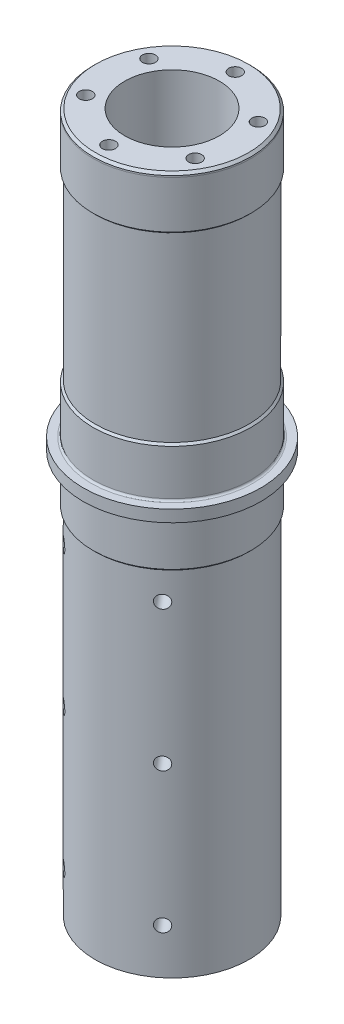
from build123d import *

# Parameters (mm, degrees)
SKETCH6_W                     = 2.15
SKETCH6_H                     = 180.5
M4_CLEARANCE_HOLE2_AT_2_COUNT = 2
M4_CLEARANCE_HOLE2_AT_2_PITCH = 16
M4_CLEARANCE_HOLE2_AT_3_COUNT = 2
M4_CLEARANCE_HOLE2_AT_3_PITCH = 27.712812921
M4_CLEARANCE_HOLE2_AT_4_COUNT = 2
M4_CLEARANCE_HOLE2_AT_4_PITCH = 32
M4_CLEARANCE_HOLE2_AT_5_COUNT = 2
M4_CLEARANCE_HOLE2_AT_5_PITCH = 27.712812921
M4_CLEARANCE_HOLE2_AT_6_COUNT = 2
M4_CLEARANCE_HOLE2_AT_6_PITCH = 16
M4_TAPPED_HOLE1_AT_2_COUNT    = 2
M4_TAPPED_HOLE1_AT_2_PITCH    = 16
M4_TAPPED_HOLE1_AT_3_COUNT    = 2
M4_TAPPED_HOLE1_AT_3_PITCH    = 27.712812921
M4_TAPPED_HOLE1_AT_4_COUNT    = 2
M4_TAPPED_HOLE1_AT_4_PITCH    = 16
M4_TAPPED_HOLE1_AT_5_COUNT    = 2
M4_TAPPED_HOLE1_AT_5_PITCH    = 27.712812921
M4_TAPPED_HOLE1_AT_6_COUNT    = 2
M4_TAPPED_HOLE1_AT_6_PITCH    = 32
SKETCH16_W                    = 1.65
SKETCH16_H                    = 19.5
SKETCH16_AT_POINT_2_W         = 1.65
SKETCH16_AT_POINT_2_H         = 19.5
SKETCH16_AT_POINT_3_W         = 1.65
SKETCH16_AT_POINT_3_H         = 19.5
SKETCH16_AT_POINT_4_W         = 1.65
SKETCH16_AT_POINT_4_H         = 19.5
SKETCH16_AT_POINT_5_W         = 1.65
SKETCH16_AT_POINT_5_H         = 19.5
SKETCH16_AT_POINT_6_W         = 1.65
SKETCH16_AT_POINT_6_H         = 19.5
CHAMFER1_SIZE                 = 0.6
FILLET1_R                     = 0.5
FILLET2_R                     = 0.4
CHAMFER2_SIZE                 = 0.5


with BuildPart() as part:
    # Sketch1 → Revolve1 (revolve)
    with BuildSketch(Plane(origin=(0, 0, 0), x_dir=(0, 0, -1), z_dir=(1, 0, 0)), mode=Mode.PRIVATE) as revolve1_sk:
        Polygon((50, 130), (50, 117), (49.5, 117), (49.5, 70), (50, 70), (50, 58), (52.5, 58), (52.5, 55), (50, 55), (50, 42.5), (49.5, 42.5), (49.5, -47), (40.5, -47), (40.5, 62.5), (42, 62.5), (42, 130), align=None)
    revolve(revolve1_sk.sketch.rotate(Axis((0, 145.844079722, -30), (0, -1, 0)), 180), axis=Axis((0, 145.844079722, -30), (0, -1, 0)))

    # Sketch12 → M4 Tapped Hole1 (revolve, cut)
    with BuildSketch(Plane(origin=(0, 130, -46), x_dir=(0, 0, 1), z_dir=(1, 0, 0))):
        Polygon((0, 0), (0, 12.491420021), (1.65, 11.5), (1.65, 0), align=None)
    m4_tapped_hole1 = revolve(axis=Axis((0, 136.35, -46), (0, -1, 0)), mode=Mode.SUBTRACT)

    # M4 Tapped Hole1 at 2: M4 Tapped Hole1 ×2
    with Locations(*[Vector(0.8660254037844387, 0, 0.5000000000000001) * (i * M4_TAPPED_HOLE1_AT_2_PITCH) for i in range(1, M4_TAPPED_HOLE1_AT_2_COUNT)]):
        add(m4_tapped_hole1, mode=Mode.SUBTRACT)

    # M4 Tapped Hole1 at 3: M4 Tapped Hole1 ×2
    with Locations(*[Vector(0.5000000000000002, 0, 0.8660254037844386) * (i * M4_TAPPED_HOLE1_AT_3_PITCH) for i in range(1, M4_TAPPED_HOLE1_AT_3_COUNT)]):
        add(m4_tapped_hole1, mode=Mode.SUBTRACT)

    # M4 Tapped Hole1 at 4: M4 Tapped Hole1 ×2
    with Locations(*[Vector(-0.8660254037844387, 0, 0.5000000000000001) * (i * M4_TAPPED_HOLE1_AT_4_PITCH) for i in range(1, M4_TAPPED_HOLE1_AT_4_COUNT)]):
        add(m4_tapped_hole1, mode=Mode.SUBTRACT)

    # M4 Tapped Hole1 at 5: M4 Tapped Hole1 ×2
    with Locations(*[Vector(-0.4999999999999997, 0, 0.8660254037844388) * (i * M4_TAPPED_HOLE1_AT_5_PITCH) for i in range(1, M4_TAPPED_HOLE1_AT_5_COUNT)]):
        add(m4_tapped_hole1, mode=Mode.SUBTRACT)

    # M4 Tapped Hole1 at 6: M4 Tapped Hole1 ×2
    with Locations(*[(0, 0, i * M4_TAPPED_HOLE1_AT_6_PITCH) for i in range(1, M4_TAPPED_HOLE1_AT_6_COUNT)]):
        add(m4_tapped_hole1, mode=Mode.SUBTRACT)

    # Sketch16 → M4 Tapped Hole2 (revolve, cut)
    with BuildSketch(Plane(origin=(12.534358389, 35.5, -15.062133359), x_dir=(0.7660444431189759, 0, -0.642787609686542), z_dir=(0, 1, 0))):
        with Locations((0.825, 9.75)):
            Rectangle(SKETCH16_W, SKETCH16_H)
    revolve(axis=Axis((16.61605971, 35.5, -10.197751145), (-0.6427876096865419, 0, -0.7660444431189758)), mode=Mode.SUBTRACT)

    # Sketch16 at point 2 (carried to point 2, square into its face) → M4 Tapped Hole2 at 2 (revolve, cut)
    with BuildSketch(Plane(origin=(12.534358389, 0, -15.062133359), x_dir=(0.766044068, 0, -0.642788057), z_dir=(0, 1, 0))):
        with Locations((0.825, 9.75)):
            Rectangle(SKETCH16_AT_POINT_2_W, SKETCH16_AT_POINT_2_H)
    revolve(axis=Axis((16.61606255, 0, -10.197753528), (-0.642788057, 0, -0.766044068)), mode=Mode.SUBTRACT)

    # Sketch16 at point 3 (carried to point 3, square into its face) → M4 Tapped Hole2 at 3 (revolve, cut)
    with BuildSketch(Plane(origin=(12.534358389, -35.5, -15.062133359), x_dir=(0.766044068, 0, -0.642788057), z_dir=(0, 1, 0))):
        with Locations((0.825, 9.75)):
            Rectangle(SKETCH16_AT_POINT_3_W, SKETCH16_AT_POINT_3_H)
    revolve(axis=Axis((16.61606255, -35.5, -10.197753528), (-0.642788057, 0, -0.766044068)), mode=Mode.SUBTRACT)

    # Sketch16 at point 4 (carried to point 4, square into its face) → M4 Tapped Hole2 at 4 (revolve, cut)
    with BuildSketch(Plane(origin=(-12.534358389, -35.5, -15.062133359), x_dir=(0.766044068, 0, 0.642788057), z_dir=(0, 1, 0))):
        with Locations((0.825, 9.75)):
            Rectangle(SKETCH16_AT_POINT_4_W, SKETCH16_AT_POINT_4_H)
    revolve(axis=Axis((-16.61606255, -35.5, -10.197753528), (0.642788057, 0, -0.766044068)), mode=Mode.SUBTRACT)

    # Sketch16 at point 5 (carried to point 5, square into its face) → M4 Tapped Hole2 at 5 (revolve, cut)
    with BuildSketch(Plane(origin=(-12.534358389, 0, -15.062133359), x_dir=(0.766044068, 0, 0.642788057), z_dir=(0, 1, 0))):
        with Locations((0.825, 9.75)):
            Rectangle(SKETCH16_AT_POINT_5_W, SKETCH16_AT_POINT_5_H)
    revolve(axis=Axis((-16.61606255, 0, -10.197753528), (0.642788057, 0, -0.766044068)), mode=Mode.SUBTRACT)

    # Sketch16 at point 6 (carried to point 6, square into its face) → M4 Tapped Hole2 at 6 (revolve, cut)
    with BuildSketch(Plane(origin=(-12.534358389, 35.5, -15.062133359), x_dir=(0.766044068, 0, 0.642788057), z_dir=(0, 1, 0))):
        with Locations((0.825, 9.75)):
            Rectangle(SKETCH16_AT_POINT_6_W, SKETCH16_AT_POINT_6_H)
    revolve(axis=Axis((-16.61606255, 35.5, -10.197753528), (0.642788057, 0, -0.766044068)), mode=Mode.SUBTRACT)

    # Chamfer1
    chamfer1_edges = [part.edges().sort_by_distance(p)[0] for p in [
        (0, 130, -50),
    ]]
    chamfer(chamfer1_edges, length=CHAMFER1_SIZE)

    # Fillet1
    fillet1_edges = [part.edges().sort_by_distance(p)[0] for p in [
        (0, 58, -50),
        (0, 55, -50),
    ]]
    fillet(fillet1_edges, radius=FILLET1_R)

    # Chamfer2
    chamfer2_edges = [part.edges().sort_by_distance(p)[0] for p in [
        (0, 42.5, -50),
        (0, 117, -49.5),
        (0, 70, -49.5),
    ]]
    chamfer(chamfer2_edges, length=CHAMFER2_SIZE - 0.0001)  # a hair under: the kernel refuses the full size


with BuildPart() as body_2:
    # Sketch2 → Revolve2 (revolve)
    with BuildSketch(Plane(origin=(0, 0, 0), x_dir=(0, 0, -1), z_dir=(1, 0, 0)), mode=Mode.PRIVATE) as revolve2_sk:
        Polygon((42, 133.5), (52.5, 133.5), (52.5, 129), (50, 129), (50, 130.5), (42, 130.5), align=None)
    revolve(revolve2_sk.sketch.rotate(Axis((0, 145.844079722, -30), (0, -1, 0)), 180), axis=Axis((0, 145.844079722, -30), (0, -1, 0)))

    # Sketch6 → M4 Clearance Hole2 (revolve, cut)
    with BuildSketch(Plane(origin=(-13.856406461, 133.5, -38), x_dir=(0, 0, 1), z_dir=(1, 0, 0))):
        with Locations((1.075, 90.25)):
            Rectangle(SKETCH6_W, SKETCH6_H)
    m4_clearance_hole2 = revolve(axis=Axis((-13.856406461, 139.85, -38), (0, -1, 0)), mode=Mode.SUBTRACT)

    # M4 Clearance Hole2 at 2: M4 Clearance Hole2 ×2
    with Locations(*[Vector(0.8660254037844387, 0, -0.5000000000000001) * (i * M4_CLEARANCE_HOLE2_AT_2_PITCH) for i in range(1, M4_CLEARANCE_HOLE2_AT_2_COUNT)]):
        add(m4_clearance_hole2, mode=Mode.SUBTRACT)

    # M4 Clearance Hole2 at 3: M4 Clearance Hole2 ×2
    with Locations(*[(i * M4_CLEARANCE_HOLE2_AT_3_PITCH, 0, 0) for i in range(1, M4_CLEARANCE_HOLE2_AT_3_COUNT)]):
        add(m4_clearance_hole2, mode=Mode.SUBTRACT)

    # M4 Clearance Hole2 at 4: M4 Clearance Hole2 ×2
    with Locations(*[Vector(0.8660254037844387, 0, 0.49999999999999994) * (i * M4_CLEARANCE_HOLE2_AT_4_PITCH) for i in range(1, M4_CLEARANCE_HOLE2_AT_4_COUNT)]):
        add(m4_clearance_hole2, mode=Mode.SUBTRACT)

    # M4 Clearance Hole2 at 5: M4 Clearance Hole2 ×2
    with Locations(*[Vector(0.5000000000000001, 0, 0.8660254037844387) * (i * M4_CLEARANCE_HOLE2_AT_5_PITCH) for i in range(1, M4_CLEARANCE_HOLE2_AT_5_COUNT)]):
        add(m4_clearance_hole2, mode=Mode.SUBTRACT)

    # M4 Clearance Hole2 at 6: M4 Clearance Hole2 ×2
    with Locations(*[(0, 0, i * M4_CLEARANCE_HOLE2_AT_6_PITCH) for i in range(1, M4_CLEARANCE_HOLE2_AT_6_COUNT)]):
        add(m4_clearance_hole2, mode=Mode.SUBTRACT)

    # Fillet2
    fillet2_edges = [body_2.edges().sort_by_distance(p)[0] for p in [
        (0, 130.5, -50),
    ]]
    fillet(fillet2_edges, radius=FILLET2_R)


solid = part.part
